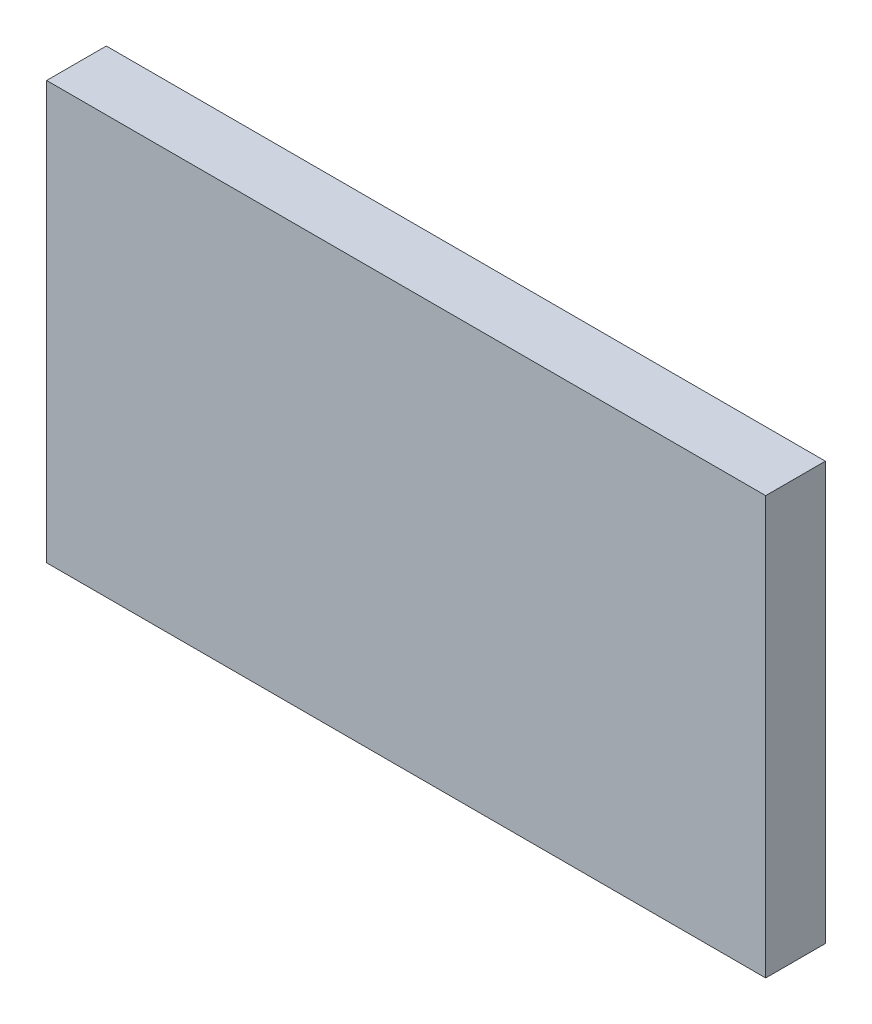
from build123d import *

# Parameters (mm, degrees)
SKETCH1_W           = 306.04968
SKETCH1_H           = 177.8
BOSS_EXTRUDE1_DEPTH = 25.4


with BuildPart() as part:
    # Sketch1 → Boss-Extrude1 (new body)
    with BuildSketch(Plane.XY):
        Rectangle(SKETCH1_W, SKETCH1_H)
    extrude(amount=-BOSS_EXTRUDE1_DEPTH)


solid = part.part
